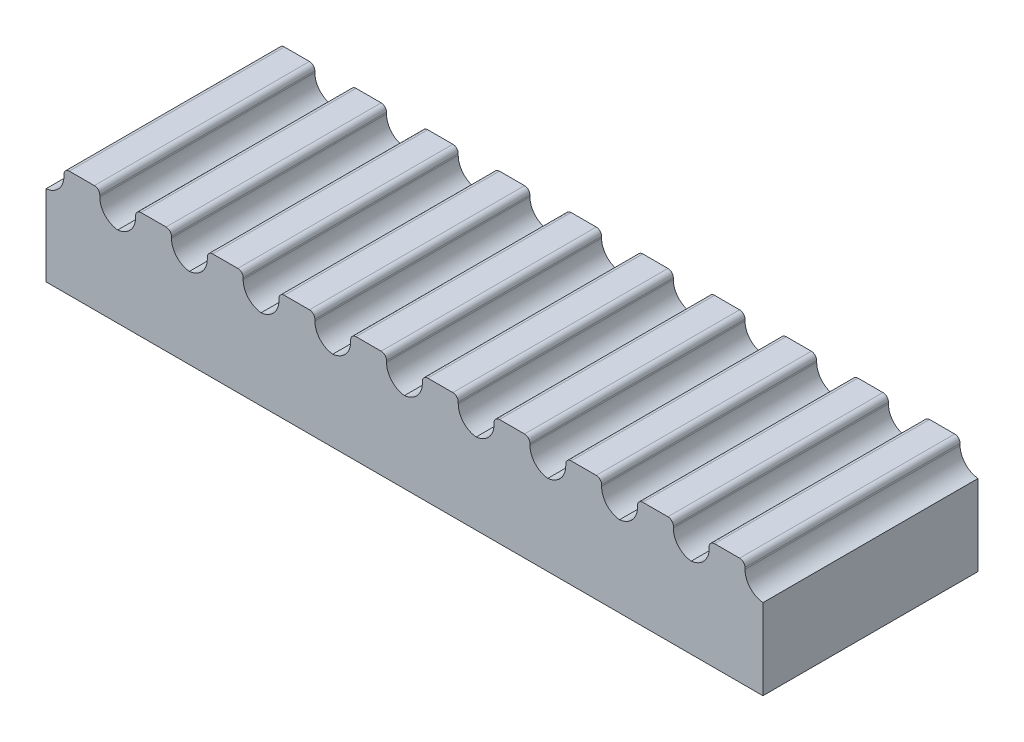
from build123d import *

# Parameters (mm, degrees)
SKETCH1_W           = 20
SKETCH1_H           = 6
BOSS_EXTRUDE1_DEPTH = 3
SKETCH2_W           = 1
SKETCH2_H           = 6
CUT_EXTRUDE1_DEPTH  = 0.75
FILLET1_R           = 0.15
FILLET2_R           = 0.555


with BuildPart() as part:
    # Sketch1 → Boss-Extrude1 (new body)
    with BuildSketch(Plane(origin=(0, 0, 0), x_dir=(1, 0, 0), z_dir=(0, 1, 0))):
        Rectangle(SKETCH1_W, SKETCH1_H)
    extrude(amount=BOSS_EXTRUDE1_DEPTH)

    # Sketch2 → Cut-Extrude1 (cut)
    with BuildSketch(Plane(origin=(0, 3, 0), x_dir=(1, 0, 0), z_dir=(0, 1, 0))):
        Rectangle(SKETCH2_W, SKETCH2_H)
        with Locations((2, 0)):
            Rectangle(SKETCH2_W, SKETCH2_H)
        with Locations((4, 0)):
            Rectangle(SKETCH2_W, SKETCH2_H)
        with Locations((6, 0)):
            Rectangle(SKETCH2_W, SKETCH2_H)
        with Locations((8, 0)):
            Rectangle(SKETCH2_W, SKETCH2_H)
        with Locations((10, 0)):
            Rectangle(SKETCH2_W, SKETCH2_H)
        with Locations((-2, 0)):
            Rectangle(SKETCH2_W, SKETCH2_H)
        with Locations((-4, 0)):
            Rectangle(SKETCH2_W, SKETCH2_H)
        with Locations((-6, 0)):
            Rectangle(SKETCH2_W, SKETCH2_H)
        with Locations((-8, 0)):
            Rectangle(SKETCH2_W, SKETCH2_H)
        with Locations((-10, 0)):
            Rectangle(SKETCH2_W, SKETCH2_H)
    extrude(amount=-CUT_EXTRUDE1_DEPTH, mode=Mode.SUBTRACT)

    # Fillet1
    fillet1_edges = [part.edges().sort_by_distance(p)[0] for p in [
        (8.5, 3, 0),
        (7.5, 3, 0),
        (9.5, 3, 0),
        (-1.5, 3, 0),
        (-2.5, 3, 0),
        (-3.5, 3, 0),
        (-4.5, 3, 0),
        (-5.5, 3, 0),
        (-6.5, 3, 0),
        (0.5, 3, 0),
        (-0.5, 3, 0),
        (-9.5, 3, 0),
        (-7.5, 3, 0),
        (-8.5, 3, 0),
        (2.5, 3, 0),
        (1.5, 3, 0),
        (4.5, 3, 0),
        (3.5, 3, 0),
        (6.5, 3, 0),
        (5.5, 3, 0),
    ]]
    fillet(fillet1_edges, radius=FILLET1_R)

    # Fillet2
    # the kernel refuses this fillet: 0.555 mm, written as the material it adds along each edge
    with BuildSketch(Plane(origin=(-8.5, 2.25, -3), x_dir=(0, 1, 0), z_dir=(0, 0, 1)), Plane(origin=(-6.5, 2.25, -3), x_dir=(0, 1, 0), z_dir=(0, 0, 1)), Plane(origin=(-4.5, 2.25, -3), x_dir=(0, 1, 0), z_dir=(0, 0, 1)), Plane(origin=(-2.5, 2.25, -3), x_dir=(0, 1, 0), z_dir=(0, 0, 1)), Plane(origin=(8.5, 2.25, 3), x_dir=(0, 1, 0), z_dir=(0, 0, -1)), Plane(origin=(6.5, 2.25, 3), x_dir=(0, 1, 0), z_dir=(0, 0, -1)), Plane(origin=(4.5, 2.25, 3), x_dir=(0, 1, 0), z_dir=(0, 0, -1)), Plane(origin=(2.5, 2.25, 3), x_dir=(0, 1, 0), z_dir=(0, 0, -1)), Plane(origin=(0.5, 2.25, 3), x_dir=(0, 1, 0), z_dir=(0, 0, -1))) as fillet2_piece_1:
        with BuildLine():
            CenterArc((FILLET2_R, -FILLET2_R), FILLET2_R, 90, 90)
            Line((0, -FILLET2_R), (-FILLET2_R * 0.02, -FILLET2_R))
            Line((-FILLET2_R * 0.02, -FILLET2_R), (-FILLET2_R * 0.02, FILLET2_R * 0.02))
            Line((-FILLET2_R * 0.02, FILLET2_R * 0.02), (FILLET2_R, FILLET2_R * 0.02))
            Line((FILLET2_R, FILLET2_R * 0.02), (FILLET2_R, 0))
        make_face()
    extrude(amount=6)
    with BuildSketch(Plane(origin=(-0.5, 2.25, -3), x_dir=(1, 0, 0), z_dir=(0, 0, 1)), Plane(origin=(1.5, 2.25, -3), x_dir=(1, 0, 0), z_dir=(0, 0, 1)), Plane(origin=(3.5, 2.25, -3), x_dir=(1, 0, 0), z_dir=(0, 0, 1)), Plane(origin=(5.5, 2.25, -3), x_dir=(1, 0, 0), z_dir=(0, 0, 1)), Plane(origin=(7.5, 2.25, -3), x_dir=(1, 0, 0), z_dir=(0, 0, 1)), Plane(origin=(-1.5, 2.25, 3), x_dir=(-1, 0, 0), z_dir=(0, 0, -1)), Plane(origin=(-3.5, 2.25, 3), x_dir=(-1, 0, 0), z_dir=(0, 0, -1)), Plane(origin=(-5.5, 2.25, 3), x_dir=(-1, 0, 0), z_dir=(0, 0, -1)), Plane(origin=(-7.5, 2.25, 3), x_dir=(-1, 0, 0), z_dir=(0, 0, -1))) as fillet2_piece_2:
        with BuildLine():
            CenterArc((FILLET2_R, FILLET2_R), FILLET2_R, 180, 90)
            Line((0, FILLET2_R), (-FILLET2_R * 0.02, FILLET2_R))
            Line((-FILLET2_R * 0.02, FILLET2_R), (-FILLET2_R * 0.02, -FILLET2_R * 0.02))
            Line((-FILLET2_R * 0.02, -FILLET2_R * 0.02), (FILLET2_R, -FILLET2_R * 0.02))
            Line((FILLET2_R, -FILLET2_R * 0.02), (FILLET2_R, 0))
        make_face()
    extrude(amount=6)
    with BuildSketch(Plane(origin=(9.5, 2.25, -3), x_dir=(0, 1, 0), z_dir=(0, 0, 1))) as fillet2_piece_3:
        with BuildLine():
            CenterArc((0.552268051, -0.555), FILLET2_R, 90, 84.31270503)
            Line((0, -0.5), (-0.011045361, -0.4989))
            ThreePointArc((-0.011045361, -0.4989), (-0.0111, -0.25), (-0.0111, 0))
            Line((-0.0111, 0), (0, 0.0111))
            Line((0, 0.0111), (0.552268051, 0.0111))
            Line((0.552268051, 0.0111), (0.552268051, 0))
        make_face()
    extrude(amount=6)
    with BuildSketch(Plane(origin=(-9.5, 2.25, 3), x_dir=(-1, 0, 0), z_dir=(0, 0, -1))) as fillet2_piece_4:
        with BuildLine():
            CenterArc((0.555, 0.552268051), FILLET2_R, 180, 84.31270503)
            Line((0, 0.552268051), (-0.0111, 0.552268051))
            Line((-0.0111, 0.552268051), (-0.0111, 0))
            Line((-0.0111, 0), (0, -0.0111))
            ThreePointArc((0, -0.0111), (0.25, -0.0111), (0.4989, -0.011045361))
            Line((0.4989, -0.011045361), (0.5, 0))
        make_face()
    extrude(amount=6)


solid = part.part
